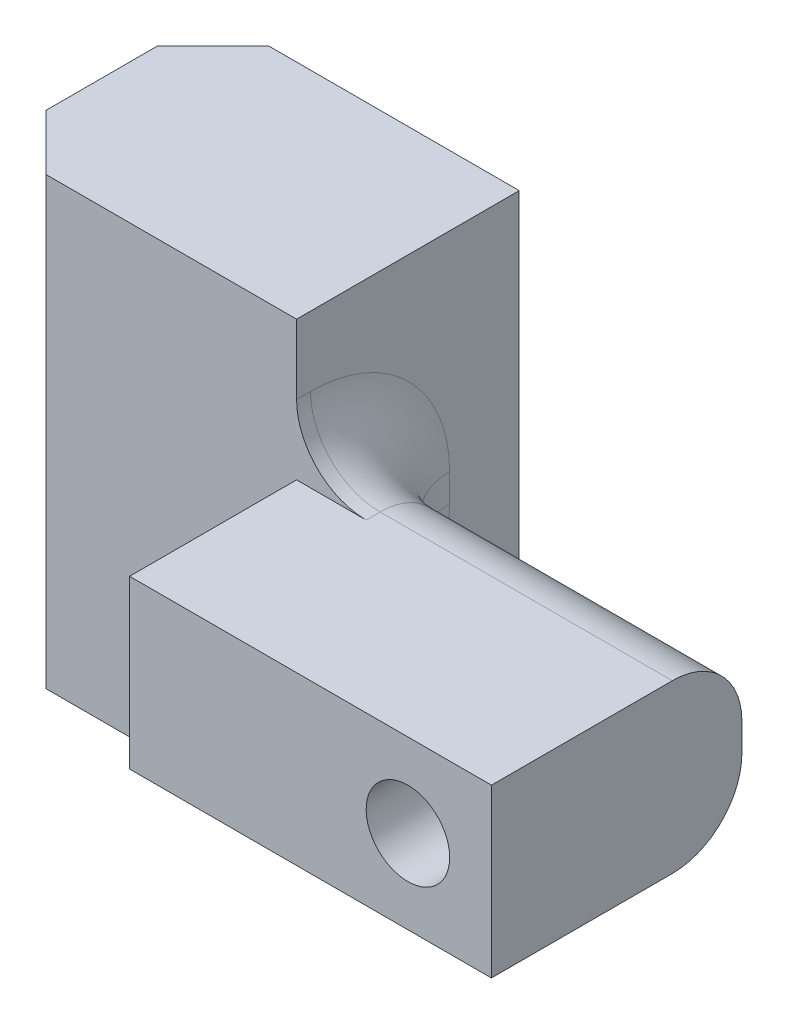
from build123d import *

# Parameters (mm, degrees)
ESBO_O1_R                     = 1.5
RESSALTO_EXTRUS_O1_DEPTH      = 9
RESSALTO_EXTRUS_O2_DEPTH      = 5
RESSALTO_EXTRUS_O2_DEPTH_BACK = 11
ESBO_O2_W                     = 11
ESBO_O2_H                     = 8
FILETE1_R                     = 2.5
CHANFRO1_SIZE                 = 2


with BuildPart() as part:
    # Esboço1 → Ressalto-extrusão1 (new body)
    with BuildSketch(Plane.XY):
        Polygon((-3, -3), (3, -3), (3, 3), (-3, 3), (-10, 3), (-10, -3), align=None)
        Circle(ESBO_O1_R, mode=Mode.SUBTRACT)
    extrude(amount=RESSALTO_EXTRUS_O1_DEPTH)

    # Esboço2 → Ressalto-extrusão2 (add, two sides: drawn at the far end of the back side and taken through both)
    with BuildSketch(Plane.XZ.offset(3).offset(-RESSALTO_EXTRUS_O2_DEPTH_BACK)):
        with Locations((-15.5, -1)):
            Rectangle(ESBO_O2_W, ESBO_O2_H)
    extrude(amount=RESSALTO_EXTRUS_O2_DEPTH + RESSALTO_EXTRUS_O2_DEPTH_BACK)

    # Filete1
    # the kernel refuses this fillet: 2.5 mm, written as the material it takes off along each edge
    with BuildSketch(Plane(origin=(-10, -3, 0), x_dir=(0, 0, 1), z_dir=(1, 0, 0))) as filete1_piece_1:
        with BuildLine():
            CenterArc((FILETE1_R, -FILETE1_R), FILETE1_R, 90, 90)
            Line((0, -FILETE1_R), (0, 0))
            Line((0, 0), (FILETE1_R, 0))
        make_face()
    extrude(amount=19.25, mode=Mode.SUBTRACT)
    with BuildSketch(Plane(origin=(9.25, 3, 0), x_dir=(0, -1, 0), z_dir=(-1, 0, 0))) as filete1_piece_2:
        with BuildLine():
            CenterArc((FILETE1_R, FILETE1_R), FILETE1_R, 180, 90)
            Line((0, FILETE1_R), (0, 0))
            Line((0, 0), (FILETE1_R, 0))
        make_face()
    extrude(amount=19.25, mode=Mode.SUBTRACT)
    # the kernel refuses this fillet: 2.5 mm, written as the material it adds along each edge
    with BuildSketch(Plane(origin=(-10, -3, 2.5), x_dir=(1, 0, 0), z_dir=(0, 0, 1)), Plane(origin=(-10, 3, 2.5), x_dir=(0, 1, 0), z_dir=(0, 0, 1))) as filete1_2_piece_1:
        with BuildLine():
            CenterArc((FILETE1_R, -FILETE1_R), FILETE1_R, 90, 90)
            Line((0, -FILETE1_R), (0, 0))
            Line((0, 0), (FILETE1_R, 0))
        make_face()
    extrude(amount=0.5)
    with BuildSketch(Plane(origin=(-10, 0.5, 0), x_dir=(0, 0, -1), z_dir=(0, -1, 0))) as filete1_2_piece_2:
        with BuildLine():
            CenterArc((FILETE1_R, FILETE1_R), FILETE1_R, 180, 90)
            Line((0, FILETE1_R), (0, 0))
            Line((0, 0), (FILETE1_R, 0))
        make_face()
    extrude(amount=1)
    with BuildSketch(Plane(origin=(-10, 0.5, 2.5), x_dir=(0, 0, -1), z_dir=(0, -1, 0))) as filete1_2_piece_3:
        with BuildLine():
            CenterArc((2.5 + FILETE1_R, FILETE1_R), FILETE1_R, 180, 90)
            Line((2.5, FILETE1_R), (2.5, 0))
            Line((2.5, 0), (2.5 + FILETE1_R, 0))
        make_face()
    revolve(axis=Axis((-10, 0.5, 2.5), (1, 0, 0)), revolution_arc=90)
    with BuildSketch(Plane(origin=(-10, -0.5, 2.5), x_dir=(0, -1, 0), z_dir=(0, 0, 1))) as filete1_2_piece_4:
        with BuildLine():
            CenterArc((2.5 + FILETE1_R, FILETE1_R), FILETE1_R, 180, 90)
            Line((2.5, FILETE1_R), (2.5, 0))
            Line((2.5, 0), (2.5 + FILETE1_R, 0))
        make_face()
    revolve(axis=Axis((-10, -0.5, 2.5), (1, 0, 0)), revolution_arc=90)

    # Chanfro1
    chanfro1_edges = [part.edges().sort_by_distance(p)[0] for p in [
        (-21, 0, -5),
        (-21, 0, 3),
    ]]
    chamfer(chanfro1_edges, length=CHANFRO1_SIZE)


solid = part.part
